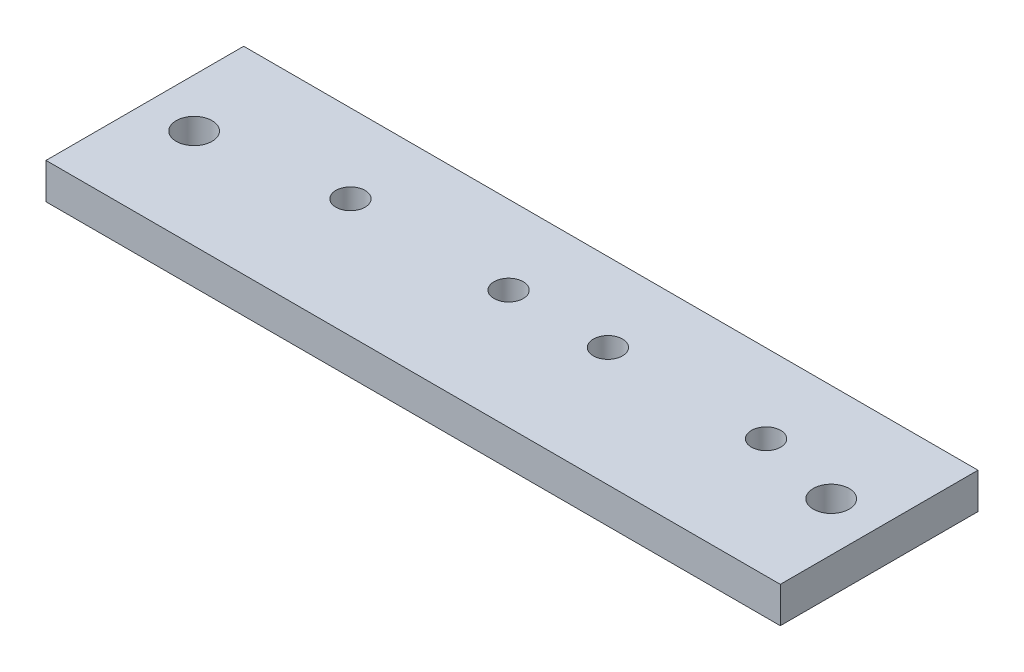
from build123d import *

# Parameters (mm, degrees)
SKETCH1_W           = 130
SKETCH1_H           = 35
BOSS_EXTRUDE1_DEPTH = 6.35
SKETCH5_R           = 3.18
CUT_EXTRUDE2_DEPTH  = 135.778790987
SKETCH8_R           = 2.58660254
CUT_EXTRUDE4_DEPTH  = 135.778790987


with BuildPart() as part:
    # Sketch1 → Boss-Extrude1 (new body)
    with BuildSketch(Plane(origin=(0, 0, 0), x_dir=(1, 0, 0), z_dir=(0, 1, 0))):
        with Locations((65, -17.5)):
            Rectangle(SKETCH1_W, SKETCH1_H)
    extrude(amount=BOSS_EXTRUDE1_DEPTH)

    # Sketch5 → Cut-Extrude2 (cut, through all)
    with BuildSketch(Plane(origin=(0, 6.35, 0), x_dir=(1, 0, 0), z_dir=(0, 1, 0))):
        with Locations((8.605, -17.382603272)):
            Circle(SKETCH5_R)
        with Locations((121.395, -17.382603272)):
            Circle(SKETCH5_R)
    extrude(amount=-CUT_EXTRUDE2_DEPTH, mode=Mode.SUBTRACT)

    # Sketch8 → Cut-Extrude4 (cut, through all)
    with BuildSketch(Plane.XZ):
        with Locations((106.422809368, 13.940552926)):
            Circle(SKETCH8_R)
        with Locations((106.422809368, -7.059447074)):
            Circle(SKETCH8_R)
        with Locations((78.422809368, -7.059447074)):
            Circle(SKETCH8_R)
        with Locations((78.422809368, 13.940552926)):
            Circle(SKETCH8_R)
        with Locations((60.84085724, 13.940552926)):
            Circle(SKETCH8_R)
        with Locations((60.84085724, -7.059447074)):
            Circle(SKETCH8_R)
        with Locations((32.84085724, -7.059447074)):
            Circle(SKETCH8_R)
        with Locations((32.84085724, 13.940552926)):
            Circle(SKETCH8_R)
    extrude(amount=-CUT_EXTRUDE4_DEPTH, mode=Mode.SUBTRACT)


solid = part.part
